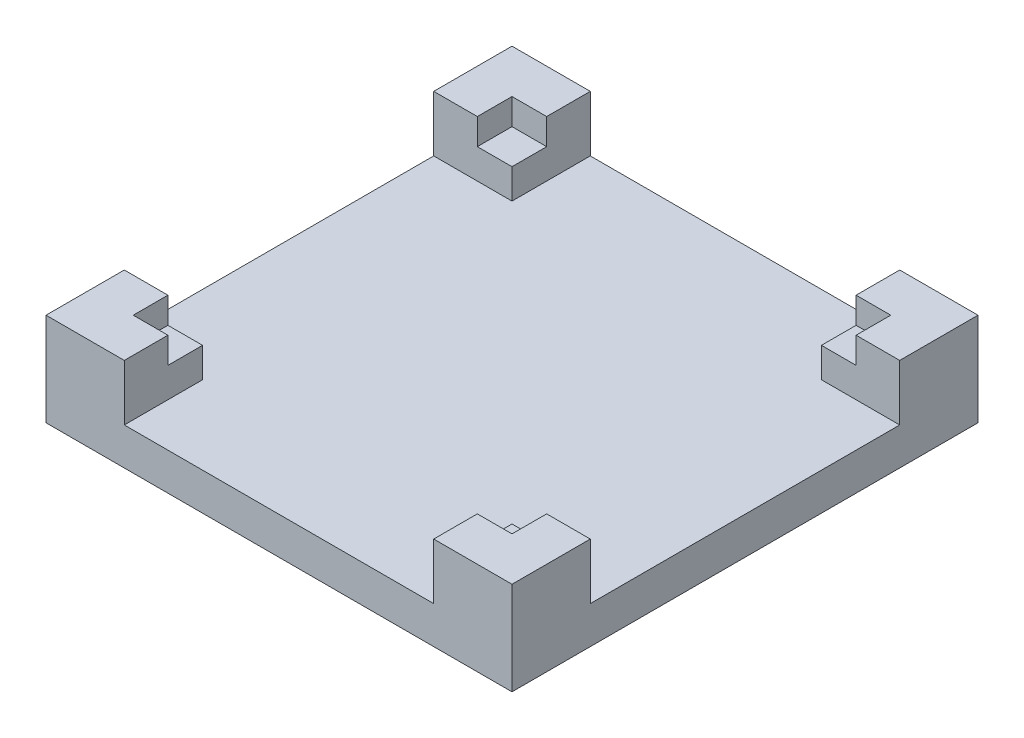
from build123d import *

# Parameters (mm, degrees)
SKETCH1_W           = 125
SKETCH1_H           = 125
BOSS_EXTRUDE1_DEPTH = 25
SKETCH2_W           = 101.6
SKETCH2_H           = 101.6
CUT_EXTRUDE1_DEPTH  = 15
SKETCH4_W           = 83
SKETCH4_H           = 11.7
SKETCH4_W_2         = 11.7
SKETCH4_H_2         = 83
CUT_EXTRUDE2_DEPTH  = 15
SKETCH5_W           = 9.3
SKETCH5_H           = 9.3
BOSS_EXTRUDE2_DEPTH = 8


with BuildPart() as part:
    # Sketch1 → Boss-Extrude1 (new body)
    with BuildSketch(Plane(origin=(0, 0, 0), x_dir=(1, 0, 0), z_dir=(0, 1, 0))):
        with Locations((62.5, 62.5)):
            Rectangle(SKETCH1_W, SKETCH1_H)
    extrude(amount=BOSS_EXTRUDE1_DEPTH)

    # Sketch2 → Cut-Extrude1 (cut)
    with BuildSketch(Plane(origin=(0, 25, 0), x_dir=(1, 0, 0), z_dir=(0, 1, 0))):
        with Locations((62.5, 62.5)):
            Rectangle(SKETCH2_W, SKETCH2_H)
    extrude(amount=-CUT_EXTRUDE1_DEPTH, mode=Mode.SUBTRACT)

    # Sketch4 → Cut-Extrude2 (cut)
    with BuildSketch(Plane(origin=(0, 25, 0), x_dir=(1, 0, 0), z_dir=(0, 1, 0))):
        with Locations((62.5, 119.15)):
            Rectangle(SKETCH4_W, SKETCH4_H)
        with Locations((5.85, 62.5)):
            Rectangle(SKETCH4_W_2, SKETCH4_H_2)
        with Locations((62.5, 5.85)):
            Rectangle(SKETCH4_W, SKETCH4_H)
        with Locations((119.15, 62.5)):
            Rectangle(SKETCH4_W_2, SKETCH4_H_2)
    extrude(amount=-CUT_EXTRUDE2_DEPTH, mode=Mode.SUBTRACT)

    # Sketch5 → Boss-Extrude2 (add)
    with BuildSketch(Plane(origin=(0, 10, 0), x_dir=(1, 0, 0), z_dir=(0, 1, 0))):
        with Locations((108.65, 16.35)):
            Rectangle(SKETCH5_W, SKETCH5_H)
        with Locations((16.35, 16.35)):
            Rectangle(SKETCH5_W, SKETCH5_H)
        with Locations((16.35, 108.65)):
            Rectangle(SKETCH5_W, SKETCH5_H)
        with Locations((108.65, 108.65)):
            Rectangle(SKETCH5_W, SKETCH5_H)
    extrude(amount=BOSS_EXTRUDE2_DEPTH)


solid = part.part
